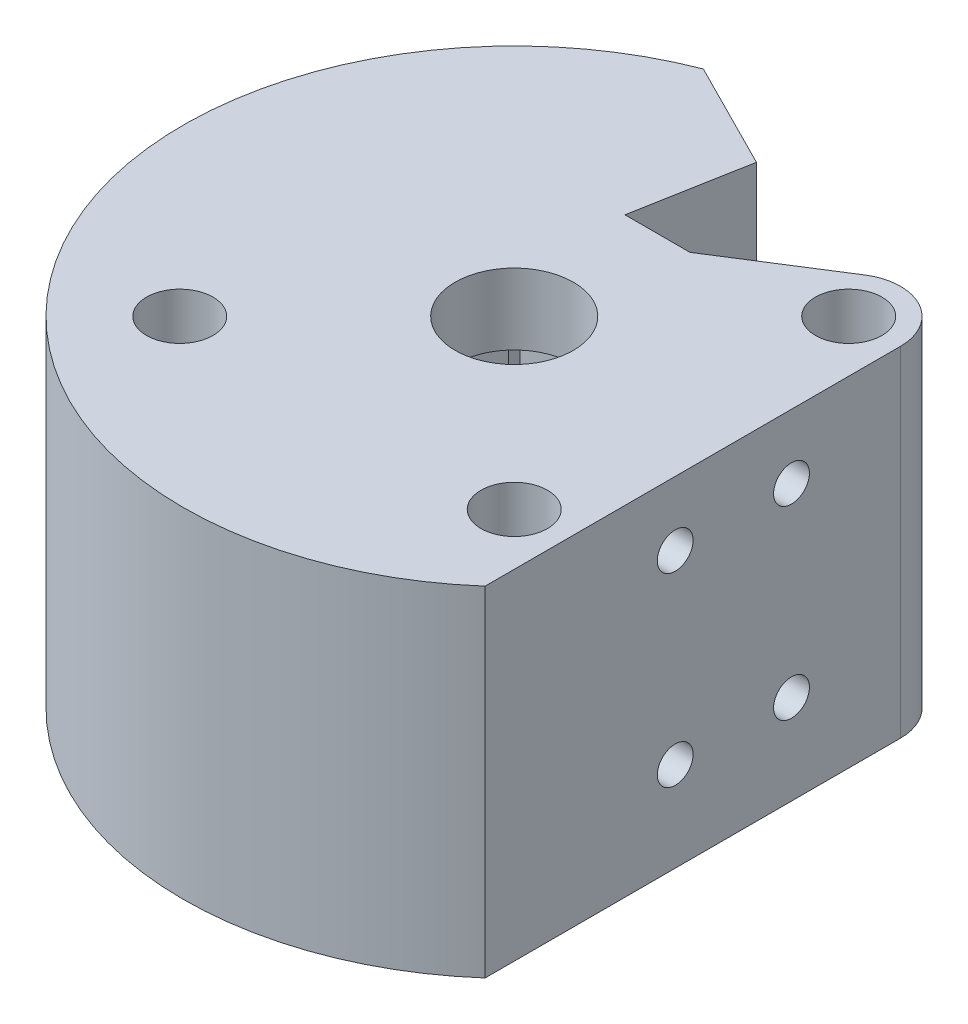
from build123d import *
from build123d.topology import SkipClean

# Parameters (mm, degrees)
SKETCH2_R           = 3.571875
BOSS_EXTRUDE1_DEPTH = 1.905
SKETCH3_R           = 3.571875
BOSS_EXTRUDE2_DEPTH = 19.558
SKETCH4_R           = 3.571875
BOSS_EXTRUDE3_DEPTH = 7.366
SKETCH5_R           = 3.571875
BOSS_EXTRUDE4_DEPTH = 7.62
SKETCH6_R           = 1.925
CUT_EXTRUDE1_DEPTH  = 5.75


with BuildPart() as part:
    # Sketch2 → Boss-Extrude1 (new body)
    with BuildSketch(Plane(origin=(0, 0, 0), x_dir=(1, 0, 0), z_dir=(0, 1, 0))):
        with BuildLine():
            Line((10.05, -30.05), (-10.05, -30.05))
            Line((-10.05, -30.05), (-10.05, 10.05))
            Line((-10.05, 10.05), (-3.4925, 10.05))
            Line((-3.4925, 10.05), (-3.4925, 15.384))
            Line((-3.4925, 15.384), (-1.318232079, 27.330889022))
            Line((-1.318232079, 27.330889022), (-10.839769253, 32.141975578))
            Line((-10.839769253, 32.141975578), (-12.849275114, 33.15734804))
            ThreePointArc((-12.849275114, 33.15734804), (-30.38177824, -18.478667457), (23.532387242, -26.659714002))
            Line((23.532387242, -26.659714002), (23.532387242, -17.960512242))
            Line((23.532387242, -17.960512242), (23.532387242, 17.960512242))
            ThreePointArc((23.532387242, 17.960512242), (20.645690581, 22.842684741), (14.976700581, 22.666110928))
            Line((14.976700581, 22.666110928), (3.4925, 15.384))
            Line((3.4925, 15.384), (3.4925, 10.05))
            Line((3.4925, 10.05), (10.05, 10.05))
            Line((10.05, 10.05), (10.05, -30.05))
        make_face()
        with Locations((17.960512242, 17.960512242)):
            Circle(SKETCH2_R, mode=Mode.SUBTRACT)
        with Locations((17.960512242, -17.960512242)):
            Circle(SKETCH2_R, mode=Mode.SUBTRACT)
        with Locations((-17.960512242, -17.960512242)):
            Circle(SKETCH2_R, mode=Mode.SUBTRACT)
    extrude(amount=BOSS_EXTRUDE1_DEPTH)

    # Sketch3 → Boss-Extrude2 (add)
    # profile 1 of 2: a face of its own
    with SkipClean():  # the faces are left unmerged after this step: merging them gives an invalid solid
        with BuildSketch(Plane(origin=(0, 1.905, 0), x_dir=(1, 0, 0), z_dir=(0, 1, 0))):
            with BuildLine():
                Line((-10.839769253, 32.141975578), (-32.833307795, -11.385051501))
                Line((-32.833307795, -11.385051501), (-23.311770621, -16.196138057))
                Line((-23.311770621, -16.196138057), (-10.3363742, 9.483241835))
                ThreePointArc((-10.3363742, 9.483241835), (-10.197196408, 9.432296011), (-10.05, 9.415))
                Line((-10.05, 9.415), (-10.05, -30.05))
                Line((-10.05, -30.05), (10.05, -30.05))
                Line((10.05, -30.05), (10.05, 10.05))
                Line((10.05, 10.05), (3.4925, 10.05))
                Line((3.4925, 10.05), (3.4925, 15.384))
                Line((3.4925, 15.384), (14.976700581, 22.666110928))
                ThreePointArc((14.976700581, 22.666110928), (20.645690581, 22.842684741), (23.532387242, 17.960512242))
                Line((23.532387242, 17.960512242), (23.532387242, -26.659714002))
                ThreePointArc((23.532387242, -26.659714002), (-30.38177824, -18.478667457), (-12.849275114, 33.15734804))
                Line((-12.849275114, 33.15734804), (-10.839769253, 32.141975578))
            make_face()
            with Locations((17.960512242, 17.960512242)):
                Circle(SKETCH3_R, mode=Mode.SUBTRACT)
            with Locations((17.960512242, -17.960512242)):
                Circle(SKETCH3_R, mode=Mode.SUBTRACT)
            with Locations((-17.960512242, -17.960512242)):
                Circle(SKETCH3_R, mode=Mode.SUBTRACT)
        # profile 2 of 2: a face of its own
        with BuildSketch(Plane(origin=(0, 1.905, 0), x_dir=(1, 0, 0), z_dir=(0, 1, 0))):
            with BuildLine():
                Line((-1.318232079, 27.330889022), (-9.7636258, 10.616758165))
                ThreePointArc((-9.7636258, 10.616758165), (-9.509133743, 10.382699101), (-9.415, 10.05))
                Line((-9.415, 10.05), (-3.4925, 10.05))
                Line((-3.4925, 10.05), (-3.4925, 15.384))
                Line((-3.4925, 15.384), (-1.318232079, 27.330889022))
            make_face()
        extrude(amount=BOSS_EXTRUDE2_DEPTH)

    # Sketch4 → Boss-Extrude3 (add)
    with SkipClean():  # the faces are left unmerged after this step: merging them gives an invalid solid
        with BuildSketch(Plane(origin=(0, 21.463, 0), x_dir=(1, 0, 0), z_dir=(0, 1, 0))):
            with BuildLine():
                Line((0, 10.05), (-3.4925, 10.05))
                Line((-3.4925, 10.05), (-9.415, 10.05))
                ThreePointArc((-9.415, 10.05), (-9.509133743, 10.382699101), (-9.7636258, 10.616758165))
                Line((-9.7636258, 10.616758165), (-1.318232079, 27.330889022))
                Line((-1.318232079, 27.330889022), (-3.4925, 15.384))
                Line((-3.4925, 15.384), (3.4925, 15.384))
                Line((3.4925, 15.384), (14.976700581, 22.666110928))
                ThreePointArc((14.976700581, 22.666110928), (20.645690581, 22.842684741), (23.532387242, 17.960512242))
                Line((23.532387242, 17.960512242), (23.532387242, -26.659714002))
                ThreePointArc((23.532387242, -26.659714002), (-30.38177824, -18.478667457), (-12.849275114, 33.15734804))
                Line((-12.849275114, 33.15734804), (-10.839769253, 32.141975578))
                Line((-10.839769253, 32.141975578), (-32.833307795, -11.385051501))
                Line((-32.833307795, -11.385051501), (-23.311770621, -16.196138057))
                Line((-23.311770621, -16.196138057), (-10.3363742, 9.483241835))
                ThreePointArc((-10.3363742, 9.483241835), (-10.197196408, 9.432296011), (-10.05, 9.415))
                Line((-10.05, 9.415), (-10.05, -30.05))
                Line((-10.05, -30.05), (10.05, -30.05))
                Line((10.05, -30.05), (10.05, 10.05))
                Line((10.05, 10.05), (3.4925, 10.05))
                Line((3.4925, 10.05), (0, 10.05))
            make_face()
            with Locations((17.960512242, 17.960512242)):
                Circle(SKETCH4_R, mode=Mode.SUBTRACT)
            with Locations((17.960512242, -17.960512242)):
                Circle(SKETCH4_R, mode=Mode.SUBTRACT)
            with Locations((-17.960512242, -17.960512242)):
                Circle(SKETCH4_R, mode=Mode.SUBTRACT)
        extrude(amount=BOSS_EXTRUDE3_DEPTH)

    # Sketch5 → Boss-Extrude4 (add)
    with SkipClean():  # the faces are left unmerged after this step: merging them gives an invalid solid
        with BuildSketch(Plane(origin=(0, 28.829, 0), x_dir=(1, 0, 0), z_dir=(0, 1, 0))):
            with BuildLine():
                Line((3.4925, 15.384), (-3.4925, 15.384))
                Line((-3.4925, 15.384), (-1.318232079, 27.330889022))
                Line((-1.318232079, 27.330889022), (-12.849275114, 33.15734804))
                ThreePointArc((-12.849275114, 33.15734804), (-30.38177824, -18.478667457), (23.532387242, -26.659714002))
                Line((23.532387242, -26.659714002), (23.532387242, 17.960512242))
                ThreePointArc((23.532387242, 17.960512242), (20.645690581, 22.842684741), (14.976700581, 22.666110928))
                Line((14.976700581, 22.666110928), (3.4925, 15.384))
            make_face()
            with Locations((17.960512242, 17.960512242)):
                Circle(SKETCH5_R, mode=Mode.SUBTRACT)
            with Locations((17.960512242, -17.960512242)):
                Circle(SKETCH5_R, mode=Mode.SUBTRACT)
            with Locations((-17.960512242, -17.960512242)):
                Circle(SKETCH5_R, mode=Mode.SUBTRACT)
            with BuildLine():
                ThreePointArc((4.490128061, 4.490128061), (0, 6.35), (-4.490128061, 4.490128061))
                ThreePointArc((-4.490128061, 4.490128061), (0, -6.35), (4.490128061, 4.490128061))
            make_face(mode=Mode.SUBTRACT)
        extrude(amount=BOSS_EXTRUDE4_DEPTH)

    # Sketch6 → Cut-Extrude1 (cut)
    with SkipClean():  # the faces are left unmerged after this step: merging them gives an invalid solid
        with BuildSketch(Plane(origin=(23.532387242, 0, 0), x_dir=(0, 0, -1), z_dir=(1, 0, 0))):
            with Locations((-6.243, 29.55058928)):
                Circle(SKETCH6_R)
            with Locations((6.243, 29.55058928)):
                Circle(SKETCH6_R)
            with Locations((6.243, 9.63508928)):
                Circle(SKETCH6_R)
            with Locations((-6.243, 9.63508928)):
                Circle(SKETCH6_R)
        extrude(amount=-CUT_EXTRUDE1_DEPTH, mode=Mode.SUBTRACT)


solid = part.part
